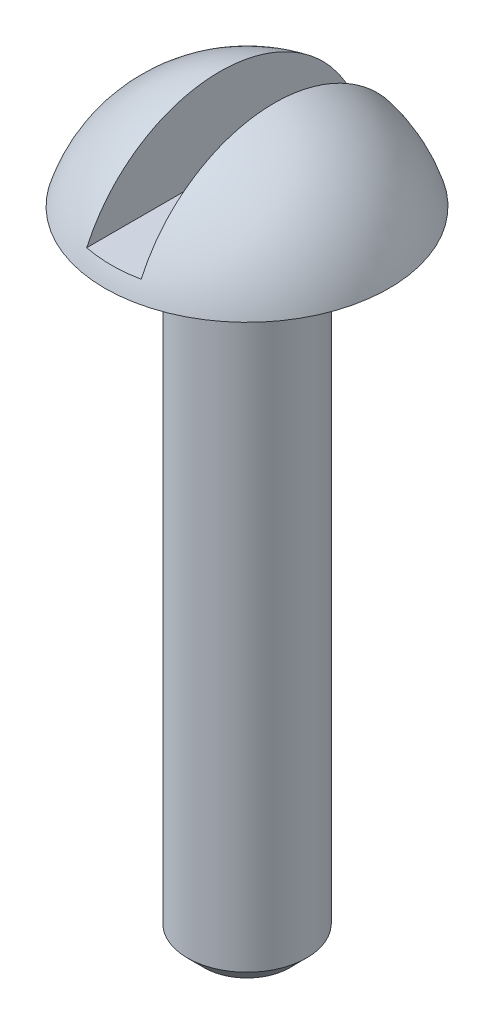
from build123d import *

# Parameters (mm, degrees)
SKETCH3_R           = 0.889
BOSS_EXTRUDE1_DEPTH = 9.525
CHAMFER1_SIZE       = 0.254
CUT_EXTRUDE1_START  = 0.254
SKETCH4_W           = 0.8128
SKETCH4_H           = 4.2418
CUT_EXTRUDE1_DEPTH  = 10.732093261


with BuildPart() as part:
    # Sketch2 → Revolve1 (revolve)
    with BuildSketch(Plane(origin=(0, 0, 0), x_dir=(0, 0, -1), z_dir=(1, 0, 0))):
        with BuildLine():
            Line((0, 0), (2.1209, 0))
            ThreePointArc((2.1209, 0), (1.320815264, 1.138053219), (0, 1.5748))
            Line((0, 1.5748), (0, 0))
        make_face()
    revolve(axis=Axis((0, 0.415157056, 0), (0, -1, 0)))

    # Sketch3 → Boss-Extrude1 (add)
    with BuildSketch(Plane.XZ):
        Circle(SKETCH3_R)
    extrude(amount=BOSS_EXTRUDE1_DEPTH)

    # Chamfer1
    chamfer1_edges = [part.edges().sort_by_distance(p)[0] for p in [
        (-0.889, -9.525, 0),
    ]]
    chamfer(chamfer1_edges, length=CHAMFER1_SIZE)

    # Sketch4 → Cut-Extrude1 (cut, through all)
    with BuildSketch(Plane(origin=(0, 0, 0), x_dir=(1, 0, 0), z_dir=(0, 1, 0)).offset(CUT_EXTRUDE1_START)):
        Rectangle(SKETCH4_W, SKETCH4_H)
    extrude(amount=CUT_EXTRUDE1_DEPTH, mode=Mode.SUBTRACT)


solid = part.part
